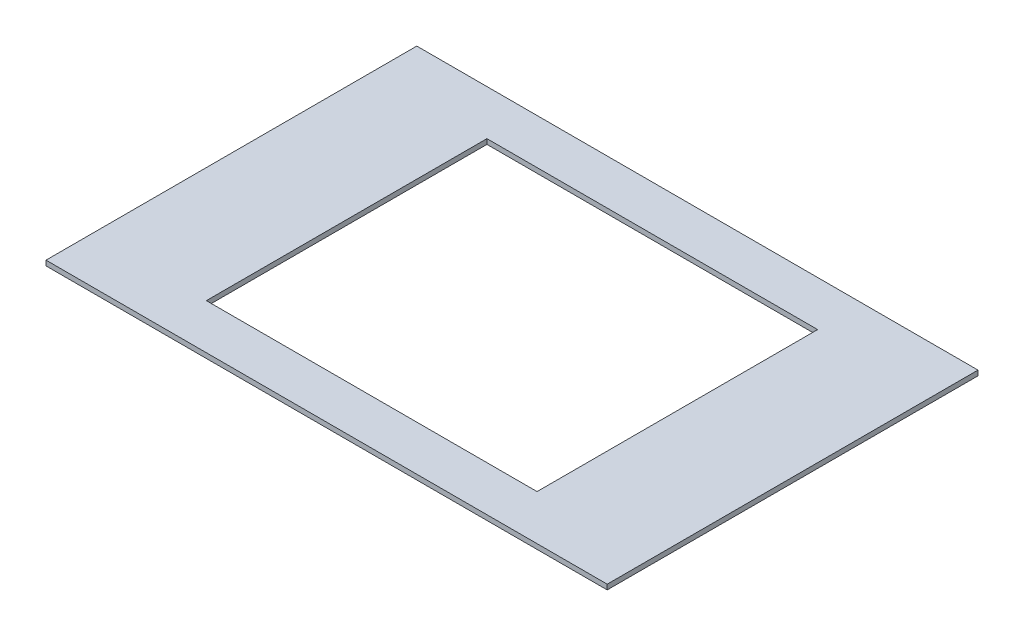
from build123d import *

# Parameters (mm, degrees)
SKETCH1_W           = 112
SKETCH1_H           = 74
BOSS_EXTRUDE1_DEPTH = 1
SKETCH5_W           = 66
SKETCH5_H           = 56
CUT_EXTRUDE2_DEPTH  = 1


with BuildPart() as part:
    # Sketch1 → Boss-Extrude1 (new body)
    with BuildSketch(Plane(origin=(0, 0, 0), x_dir=(1, 0, 0), z_dir=(0, 1, 0))):
        Rectangle(SKETCH1_W, SKETCH1_H)
    extrude(amount=BOSS_EXTRUDE1_DEPTH)

    # Sketch5 → Cut-Extrude2 (cut)
    with BuildSketch(Plane(origin=(0, 1, 0), x_dir=(1, 0, 0), z_dir=(0, 1, 0))):
        Rectangle(SKETCH5_W, SKETCH5_H)
    extrude(amount=-CUT_EXTRUDE2_DEPTH, mode=Mode.SUBTRACT)


solid = part.part
